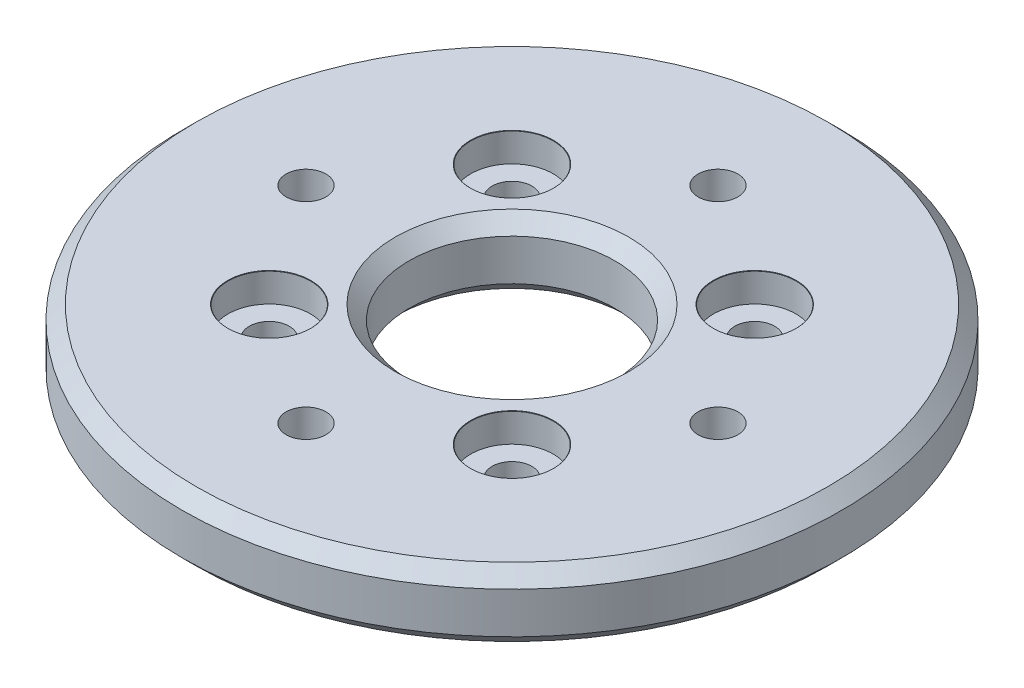
from build123d import *

# Parameters (mm, degrees)
SKETCH1_R               = 24
BOSS_EXTRUDE1_DEPTH     = 5
CUT_EXTRUDE1_DEPTH      = 35.307433597
CUT_EXTRUDE1_DEPTH_BACK = 35.307433597
SKETCH8_R               = 7.5
CHAMFER1_SIZE           = 1
CHAMFER2_SIZE           = 1


# Read off the part's stored shape, not the designer's step: CBORE for M2.5 Pan Head Screw1, CBORE for M2.5 Pan Head Screw2
with BuildPart() as part:
    # Sketch1 → Boss-Extrude1 (new body)
    with BuildSketch(Plane(origin=(0, 0, 0), x_dir=(1, 0, 0), z_dir=(0, 1, 0))):
        with Locations(Location((0, 0, 0), (0, 0, 270))):
            Circle(SKETCH1_R)
    extrude(amount=BOSS_EXTRUDE1_DEPTH)

    # CBORE for M2.5 Pan Head Screw1 outline → CBORE for M2.5 Pan Head Screw1 (revolve, cut)
    with BuildSketch(Plane(origin=(8.838834765, 0, 8.838834765), x_dir=(1, 0, 0), z_dir=(0, 0, 1))):
        Polygon((0, 0), (1.45, 0), (1.45, 2.9), (3, 2.9), (3, 4.975), (3.025, 5), (0, 5), align=None)
    revolve(axis=Axis((8.838834765, 0, 8.838834765), (0, 1, 0)), mode=Mode.SUBTRACT)

    # CBORE for M2.5 Pan Head Screw1 2 outline → CBORE for M2.5 Pan Head Screw1 2 (revolve, cut)
    with BuildSketch(Plane(origin=(-8.838834765, 0, -8.838834765), x_dir=(1, 0, 0), z_dir=(0, 0, 1))):
        Polygon((0, 5), (0, 0), (1.45, 0), (1.45, 2.9), (3, 2.9), (3, 4.975), (3.025, 5), align=None)
    revolve(axis=Axis((-8.838834765, 0, -8.838834765), (0, 1, 0)), mode=Mode.SUBTRACT)

    # CBORE for M2.5 Pan Head Screw1 3 outline → CBORE for M2.5 Pan Head Screw1 3 (revolve, cut)
    with BuildSketch(Plane(origin=(-8.838834765, 0, 8.838834765), x_dir=(1, 0, 0), z_dir=(0, 0, 1))):
        Polygon((0, 5), (0, 0), (1.45, 0), (1.45, 2.9), (3, 2.9), (3, 4.975), (3.025, 5), align=None)
    revolve(axis=Axis((-8.838834765, 0, 8.838834765), (0, 1, 0)), mode=Mode.SUBTRACT)

    # CBORE for M2.5 Pan Head Screw1 4 outline → CBORE for M2.5 Pan Head Screw1 4 (revolve, cut)
    with BuildSketch(Plane(origin=(8.838834765, 0, -8.838834765), x_dir=(1, 0, 0), z_dir=(0, 0, 1))):
        Polygon((0, 5), (0, 0), (1.45, 0), (1.45, 2.9), (3, 2.9), (3, 4.975), (3.025, 5), align=None)
    revolve(axis=Axis((8.838834765, 0, -8.838834765), (0, 1, 0)), mode=Mode.SUBTRACT)

    # CBORE for M2.5 Pan Head Screw2 outline → CBORE for M2.5 Pan Head Screw2 (revolve, cut)
    with BuildSketch(Plane.XY.offset(-15)):
        Polygon((1.45, 2.1), (1.45, 5), (0, 5), (0, 0), (3.025, 0), (3, 0.025), (3, 2.1), align=None)
    revolve(axis=Axis((0, 0, -15), (0, 1, 0)), mode=Mode.SUBTRACT)

    # CBORE for M2.5 Pan Head Screw2 2 outline → CBORE for M2.5 Pan Head Screw2 2 (revolve, cut)
    with BuildSketch(Plane.XY.offset(15)):
        Polygon((0, 0), (3.025, 0), (3, 0.025), (3, 2.1), (1.45, 2.1), (1.45, 5), (0, 5), align=None)
    revolve(axis=Axis((0, 0, 15), (0, 1, 0)), mode=Mode.SUBTRACT)

    # CBORE for M2.5 Pan Head Screw2 3 outline → CBORE for M2.5 Pan Head Screw2 3 (revolve, cut)
    with BuildSketch(Plane(origin=(-15, 0, 0), x_dir=(1, 0, 0), z_dir=(0, 0, 1))):
        Polygon((0, 0), (3.025, 0), (3, 0.025), (3, 2.1), (1.45, 2.1), (1.45, 5), (0, 5), align=None)
    revolve(axis=Axis((-15, 0, 0), (0, 1, 0)), mode=Mode.SUBTRACT)

    # CBORE for M2.5 Pan Head Screw2 4 outline → CBORE for M2.5 Pan Head Screw2 4 (revolve, cut)
    with BuildSketch(Plane(origin=(15, 0, 0), x_dir=(1, 0, 0), z_dir=(0, 0, 1))):
        Polygon((0, 0), (3.025, 0), (3, 0.025), (3, 2.1), (1.45, 2.1), (1.45, 5), (0, 5), align=None)
    revolve(axis=Axis((15, 0, 0), (0, 1, 0)), mode=Mode.SUBTRACT)

    # Sketch8 → Cut-Extrude1 (cut, two sides: drawn at the far end of the back side and taken through both)
    with BuildSketch(Plane(origin=(0, 5, 0), x_dir=(1, 0, 0), z_dir=(0, 1, 0)).offset(-CUT_EXTRUDE1_DEPTH_BACK)):
        with Locations(Location((0, 0, 0), (0, 0, 270))):
            Circle(SKETCH8_R)
    extrude(amount=CUT_EXTRUDE1_DEPTH + CUT_EXTRUDE1_DEPTH_BACK, mode=Mode.SUBTRACT)

    # Chamfer1
    chamfer1_edges = [part.edges().sort_by_distance(p)[0] for p in [
        (0, 5, -7.5),
        (0, 0, -7.5),
    ]]
    chamfer(chamfer1_edges, length=CHAMFER1_SIZE)

    # Chamfer2
    chamfer2_edges = [part.edges().sort_by_distance(p)[0] for p in [
        (0, 0, -24),
        (0, 5, -24),
    ]]
    chamfer(chamfer2_edges, length=CHAMFER2_SIZE)


solid = part.part
